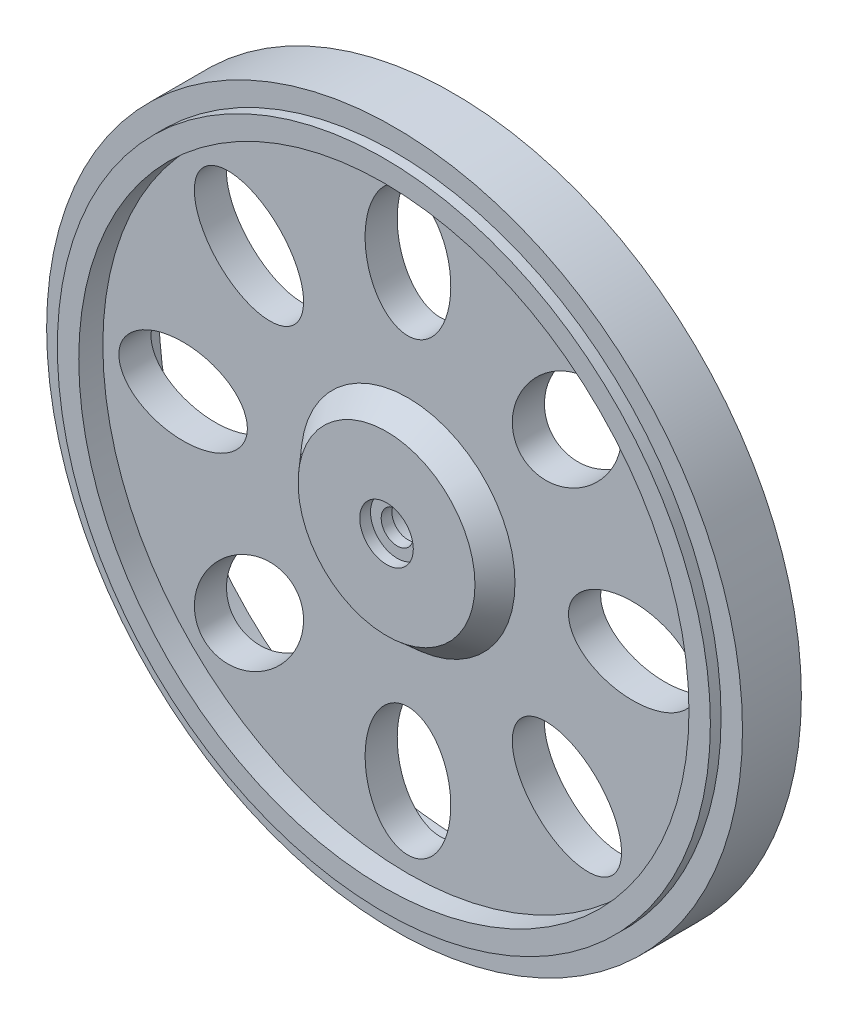
from build123d import *

# Parameters (mm, degrees)
SKETCH2_R           = 10
EXTRUDE1_DEPTH      = 2
EXTRUDE1_TAPER      = 41
SKETCH3_R           = 5.5
EXTRUDE2_DEPTH      = 4
EXTRUDE2_TAPER      = 15
SKETCH4_R           = 2.5
EXTRUDE3_DEPTH      = 1
EXTRUDE4_DEPTH      = 24
EXTRUDE4_DEPTH_BACK = 15
SKETCH5_R           = 1.5
SKETCH6_RX          = 6
SKETCH6_RY          = 4
EXTRUDE5_DEPTH      = 15
CIRPATTERN2_COUNT   = 8
SKETCH7_R           = 2.75
EXTRUDE6_DEPTH      = 7


with BuildPart() as part:
    # Sketch1 → Revolve1 (revolve)
    with BuildSketch(Plane(origin=(0, 0, 0), x_dir=(0, 0, -1), z_dir=(1, 0, 0))):
        Polygon((-3.75, 28.5), (-1.5, 28.5), (-1.5, 0), (1.5, 0), (1.5, 28.5), (3.75, 28.5), (3.75, 30.5), (2.75, 30.5), (2.75, 32.5), (-2.75, 32.5), (-2.75, 30.5), (-3.75, 30.5), align=None)
    revolve(axis=Axis((0, 0, 21.188406287), (0, 0, -1)))

    # Sketch2 → Extrude1 (add)
    with BuildSketch(Plane.XY.offset(1.5)):
        Circle(SKETCH2_R)
    extrude(amount=EXTRUDE1_DEPTH, taper=EXTRUDE1_TAPER)

    # Sketch3 → Extrude2 (add)
    with BuildSketch(Plane(origin=(0, 0, -1.5), x_dir=(-1, 0, 0), z_dir=(0, 0, -1))):
        Circle(SKETCH3_R)
    extrude(amount=EXTRUDE2_DEPTH, taper=EXTRUDE2_TAPER)

    # Sketch4 → Extrude3 (cut)
    with BuildSketch(Plane.XY.offset(3.5)):
        Circle(SKETCH4_R)
    extrude(amount=-EXTRUDE3_DEPTH, mode=Mode.SUBTRACT)

    # Sketch5 → Extrude4 (cut, two sides: drawn at the far end of the back side and taken through both)
    with BuildSketch(Plane.XY.offset(2.5).offset(-EXTRUDE4_DEPTH_BACK)):
        Circle(SKETCH5_R)
    extrude(amount=EXTRUDE4_DEPTH + EXTRUDE4_DEPTH_BACK, mode=Mode.SUBTRACT)

    # Sketch6 → Extrude5 (cut)
    with BuildSketch(Plane.XY.offset(1.5)):
        with Locations(Location((0, 21), (0, 0, 90))):
            Ellipse(SKETCH6_RX, SKETCH6_RY)
    extrude5 = extrude(amount=-EXTRUDE5_DEPTH, mode=Mode.SUBTRACT)

    # CirPattern2: Extrude5 ×8 about axis
    cirpattern2_axis = Axis((0, 0, 21.188406287), (0, 0, 1))
    for i in range(1, CIRPATTERN2_COUNT):
        add(extrude5.rotate(cirpattern2_axis, i * 360 / CIRPATTERN2_COUNT), mode=Mode.SUBTRACT)

    # Sketch7 → Extrude6 (cut)
    with BuildSketch(Plane(origin=(0, 0, -5.5), x_dir=(-1, 0, 0), z_dir=(0, 0, -1))):
        Circle(SKETCH7_R)
    extrude(amount=-EXTRUDE6_DEPTH, mode=Mode.SUBTRACT)


solid = part.part
